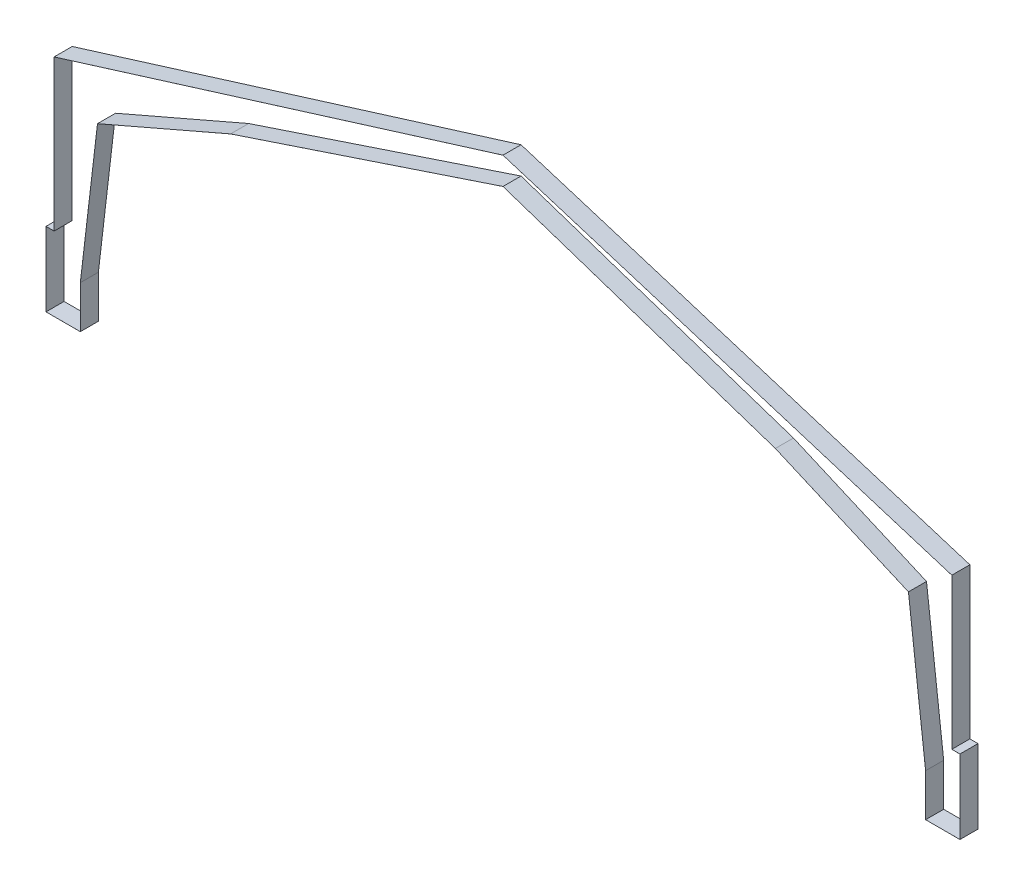
from build123d import *

# Parameters (mm, degrees)
EXTRUIR_L_MINA1_DEPTH = 254


with BuildPart() as part:
    # Croquis1 → Extruir-Lámina1 (new, symmetric)
    with BuildSketch(Plane.XY):
        Polygon((20513.007562206, 6929.762411967), (24256.764775023, 5308.425074033), (24739.346, 1193.785155811), (24739.346, -0.254), (25705.054, -0.254), (25705.054, 2083.054), (25476.454, 2083.054), (25476.454, 6324.787116444), (12852.4, 10243.069953546), (228.346, 6324.787116444), (228.346, 2083.054), (-0.254, 2083.054), (-0.254, -0.254), (965.454, -0.254), (965.454, 1193.785155811), (1448.035224977, 5308.425074033), (5191.792437794, 6929.762411967), (12852.4, 9480.536289437), align=None)
        Polygon((20513.098327776, 6929.999900065), (24257, 5308.6), (24739.6, 1193.8), (24739.6, 0), (25704.8, 0), (25704.8, 2082.8), (25476.2, 2082.8), (25476.2, 6324.6), (12852.4, 10242.804), (228.6, 6324.6), (228.6, 2082.8), (0, 2082.8), (0, 0), (965.2, 0), (965.2, 1193.8), (1447.8, 5308.6), (5191.701672224, 6929.999900065), (12852.4, 9480.804), align=None, mode=Mode.SUBTRACT)
    extrude(amount=EXTRUIR_L_MINA1_DEPTH, both=True)


solid = part.part
